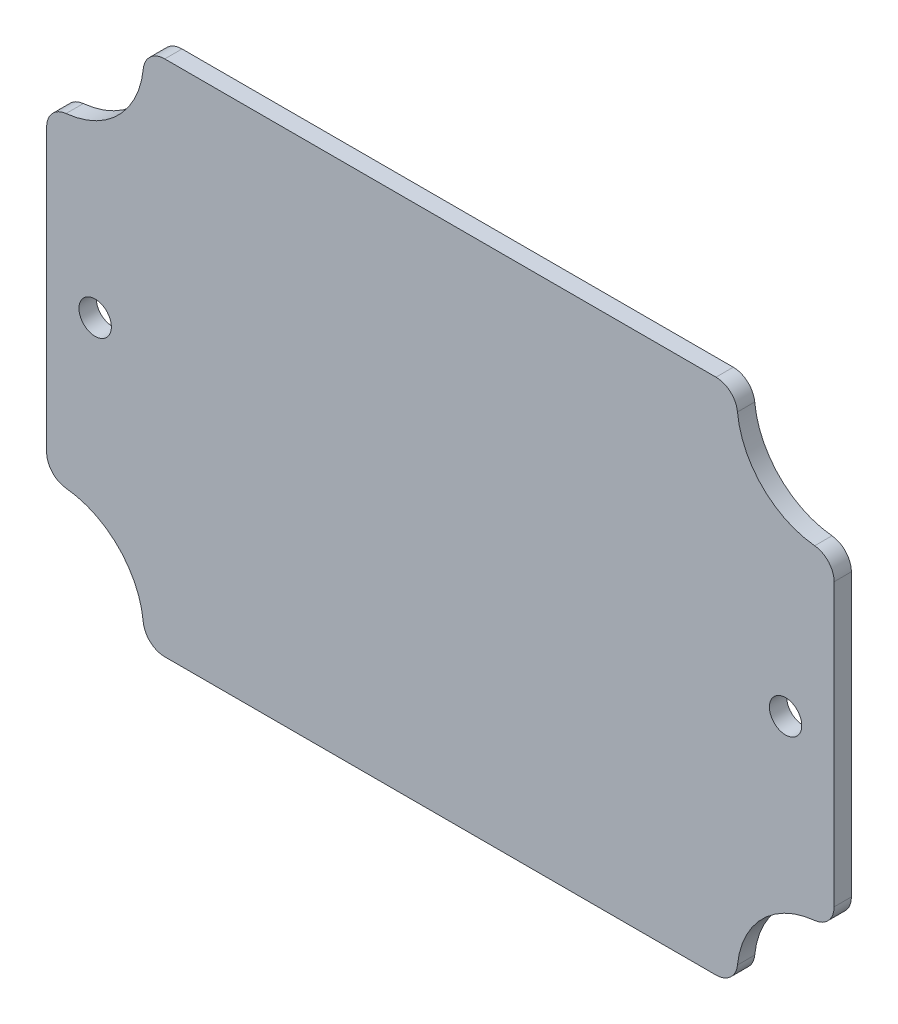
from build123d import *

# Parameters (mm, degrees)
SKETCH1_W                                = 73
SKETCH1_H                                = 48
BOSS_EXTRUDE1_DEPTH                      = 1.6
CUT_EXTRUDE1_DEPTH                       = 44.712812767
MIRROR1_AT_THE_SECOND_PLANE_COPY_1_DEPTH = 44.712812767
FILLET1_R                                = 2
SKETCH3_R                                = 1.5
CUT_EXTRUDE2_DEPTH                       = 44.712812767


with BuildPart() as part:
    # Sketch1 → Boss-Extrude1 (new body)
    with BuildSketch(Plane.XY):
        Rectangle(SKETCH1_W, SKETCH1_H)
    extrude(amount=BOSS_EXTRUDE1_DEPTH)

    # Sketch2 → Cut-Extrude1 (cut, through all)
    with BuildSketch(Plane.XY.offset(1.6)):
        with BuildLine():
            Line((-27.5, 23), (-27.5, 24))
            Line((-27.5, 24), (-36.5, 24))
            Line((-36.5, 24), (-36.5, 15))
            Line((-36.5, 15), (-35.5, 15))
            ThreePointArc((-35.5, 15), (-29.843145751, 17.343145751), (-27.5, 23))
        make_face()
    cut_extrude1 = extrude(amount=-CUT_EXTRUDE1_DEPTH, mode=Mode.SUBTRACT)

    # Mirror1: Cut-Extrude1 across plane
    add(cut_extrude1.mirror(Plane(origin=(0, 0, 0), x_dir=(0, 0, 1), z_dir=(1, 0, 0))), mode=Mode.SUBTRACT)

    # Mirror1 at the second plane: Cut-Extrude1 across plane
    add(cut_extrude1.mirror(Plane.ZX), mode=Mode.SUBTRACT)

    # Mirror1 at the second plane copy 1 sketc → Mirror1 at the second plane copy 1 (cut, through all)
    with BuildSketch(Plane(origin=(0, 0, 1.6), x_dir=(-1, 0, 0), z_dir=(0, 0, 1))):
        with BuildLine():
            Line((-27.5, 23), (-27.5, 24))
            Line((-27.5, 24), (-36.5, 24))
            Line((-36.5, 24), (-36.5, 15))
            Line((-36.5, 15), (-35.5, 15))
            ThreePointArc((-35.5, 15), (-29.843145751, 17.343145751), (-27.5, 23))
        make_face()
    extrude(amount=-MIRROR1_AT_THE_SECOND_PLANE_COPY_1_DEPTH, mode=Mode.SUBTRACT)

    # Fillet1
    # the kernel refuses this fillet: 2 mm, written as the material it takes off along each edge
    with BuildSketch(Plane(origin=(-36.5, 15, 6.474685928), x_dir=(0.9997519364152339, 0.022272530929157337, 0), z_dir=(0, 0, -1)), Plane(origin=(-27.5, -24, 6.474685928), x_dir=(-0.022272530929167148, 0.9997519364152335, 0), z_dir=(0, 0, -1)), Plane(origin=(36.5, -15, 6.474685928), x_dir=(-0.9997519364152339, -0.022272530929157337, 0), z_dir=(0, 0, -1))) as fillet1_piece_1:
        with BuildLine():
            CenterArc((1.956075236, 1.99393574), FILLET1_R, 181.276227552, 84.260829523)
            Line((-0.043428637, 1.949390678), (-0.243379025, 1.944936172))
            Line((-0.243379025, 1.944936172), (-0.199950387, -0.004454506))
            Line((-0.199950387, -0.004454506), (0.004454506, -0.199950387))
            ThreePointArc((0.004454506, -0.199950387), (1.004206443, -0.177677856), (1.784883764, -0.199393574))
            Line((1.784883764, -0.199393574), (1.800446625, 0))
        make_face()
    extrude(amount=11.349371855, mode=Mode.SUBTRACT)
    with BuildSketch(Plane(origin=(-27.5, 24, 6.474685928), x_dir=(1, 0, 0), z_dir=(0, 0, -1)), Plane(origin=(-36.5, -15, 6.474685928), x_dir=(0, 1, 0), z_dir=(0, 0, -1)), Plane(origin=(36.5, 15, 6.474685928), x_dir=(0, -1, 0), z_dir=(0, 0, -1)), Plane(origin=(27.5, -24, 6.474685928), x_dir=(-1, 0, 0), z_dir=(0, 0, -1))) as fillet1_piece_2:
        with BuildLine():
            CenterArc((1.949874371, 2), FILLET1_R, 185.739170477, 84.260829523)
            Line((-0.040100503, 1.8), (-0.239097991, 1.78))
            ThreePointArc((-0.239097991, 1.78), (-0.2, 1), (-0.2, 0))
            Line((-0.2, 0), (0, -0.2))
            Line((0, -0.2), (1.949874371, -0.2))
            Line((1.949874371, -0.2), (1.949874371, 0))
        make_face()
    extrude(amount=11.349371855, mode=Mode.SUBTRACT)
    with BuildSketch(Plane(origin=(27.5, 24, 6.474685928), x_dir=(-1, 0, 0), z_dir=(0, 0, -1))) as fillet1_piece_3:
        with BuildLine():
            CenterArc((1.949874371, -2), FILLET1_R, 90, 84.260829523)
            Line((-0.040100503, -1.8), (-0.239097991, -1.78))
            ThreePointArc((-0.239097991, -1.78), (-0.2, -1), (-0.2, 0))
            Line((-0.2, 0), (0, 0.2))
            Line((0, 0.2), (1.949874371, 0.2))
            Line((1.949874371, 0.2), (1.949874371, 0))
        make_face()
    extrude(amount=11.349371855, mode=Mode.SUBTRACT)

    # Sketch3 → Cut-Extrude2 (cut, through all)
    with BuildSketch(Plane.XY.offset(1.6)):
        with Locations((-32, 0)):
            Circle(SKETCH3_R)
        with Locations((32, 0)):
            Circle(SKETCH3_R)
    extrude(amount=-CUT_EXTRUDE2_DEPTH, mode=Mode.SUBTRACT)


solid = part.part
